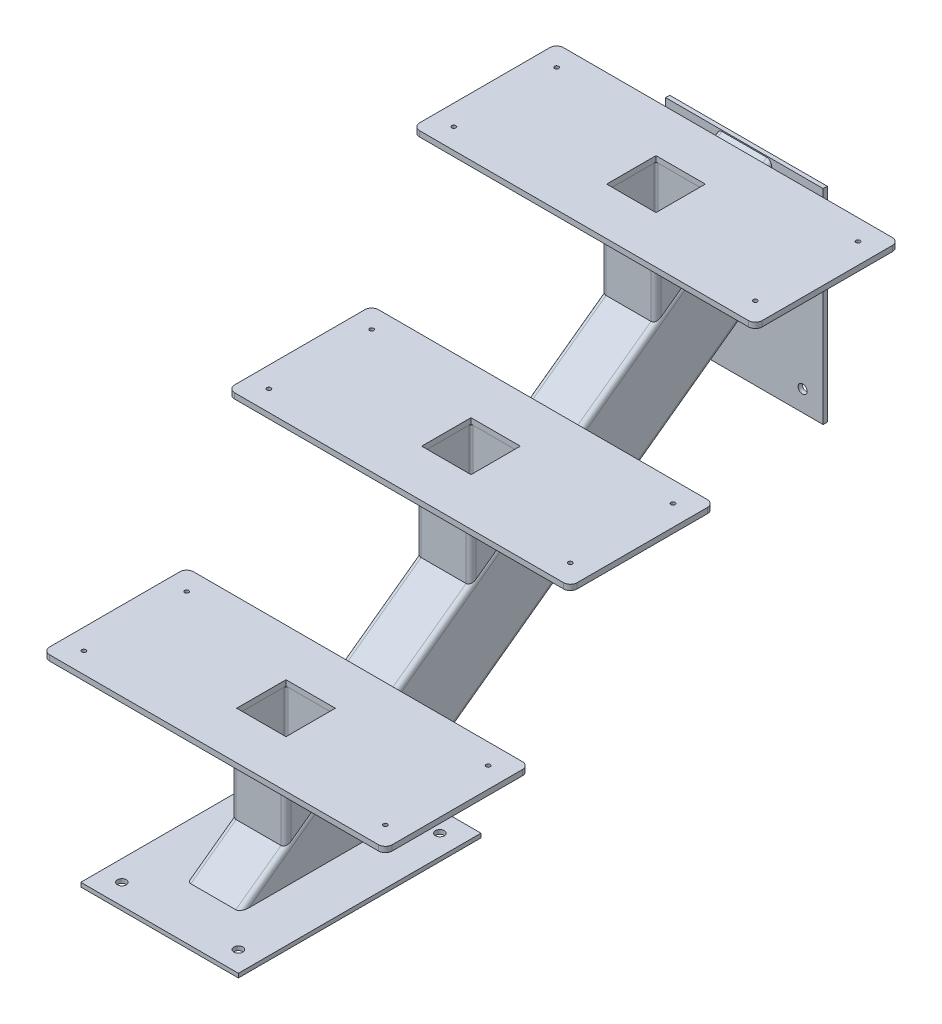
from build123d import *

# Parameters (mm, degrees)
BOSS_EXTRUDE1_START             = 3524.25
SKETCH1_W                       = 1000
SKETCH1_H                       = 270
BOSS_EXTRUDE1_DEPTH             = 40
BOSS_EXTRUDE2_START             = 3720.5
SKETCH1_53_W                    = 1000
SKETCH1_53_H                    = 270
BOSS_EXTRUDE2_DEPTH             = 40
BOSS_EXTRUDE3_START             = 3916.75
SKETCH1_54_W                    = 1000
SKETCH1_54_H                    = 270
BOSS_EXTRUDE3_DEPTH             = 40
MEMBER_8645_68_120_80_4_1_DEPTH = 975.849936604
MEMBER_8639_82_80_80_4_1_DEPTH  = 108.125
SKETCH20_R                      = 3
SKETCH20_W                      = 72
SKETCH20_H                      = 72
BASE_FLANGE1_DEPTH              = 8
BODY_START                      = 54.0625
BODY_5_RUN_ON_DEPTH             = 83.136574
TRIM_EXTEND6_START              = 3195.932240577
TRIM_EXTEND6_OUTLINE_W          = 80
TRIM_EXTEND6_OUTLINE_H          = 790.842725113
TRIM_EXTEND6_DEPTH              = 97.067759423
TRIM_EXTEND6_START_2            = 3293
TRIM_EXTEND6_2_OUTLINE_W        = 80
TRIM_EXTEND6_2_OUTLINE_H        = 72.157274887
TRIM_EXTEND6_2_DEPTH            = 575
END_START                       = -3847.887893241
END_CAP2_OUTLINE_W              = 6
END_CAP2_OUTLINE_H              = 354.099333146
END_CAP2_DEPTH                  = 230
END_START_2                     = 3293
END_CAP2_2_OUTLINE_W            = 83
END_CAP2_2_OUTLINE_H            = 784.842725113
END_CAP2_2_DEPTH                = 6
END_START_3                     = 3299
END_CAP2_3_OUTLINE_W            = 83
END_CAP2_3_OUTLINE_H            = 6
END_CAP2_3_DEPTH                = 569
END_CAP2_4_OUTLINE_W            = 298.349978258
END_CAP2_4_OUTLINE_H            = 6
END_CAP2_4_DEPTH                = 230
SKETCH25_R                      = 6.5
CUT_EXTRUDE1_DEPTH              = 10
SKETCH26_R                      = 6.5
CUT_EXTRUDE2_DEPTH              = 10


with BuildPart() as part:
    # Sketch1 → Boss-Extrude1 (new body)
    with BuildSketch(Plane(origin=(0, 0, 0), x_dir=(1, 0, 0), z_dir=(0, 1, 0)).offset(BOSS_EXTRUDE1_START)):
        with Locations((-3732.887893241, 4296.842725113)):
            Rectangle(SKETCH1_W, SKETCH1_H)
    extrude(amount=-BOSS_EXTRUDE1_DEPTH)


with BuildPart() as body_2:
    # Sketch1<53> → Boss-Extrude2 (new body)
    with BuildSketch(Plane(origin=(0, 0, 0), x_dir=(1, 0, 0), z_dir=(0, 1, 0)).offset(BOSS_EXTRUDE2_START)):
        with Locations((-3732.887893241, 4566.842725113)):
            Rectangle(SKETCH1_53_W, SKETCH1_53_H)
    extrude(amount=-BOSS_EXTRUDE2_DEPTH)


with BuildPart() as body_3:
    # Sketch1<54> → Boss-Extrude3 (new body)
    with BuildSketch(Plane(origin=(0, 0, 0), x_dir=(1, 0, 0), z_dir=(0, 1, 0)).offset(BOSS_EXTRUDE3_START)):
        with Locations((-3732.887893241, 4836.842725113)):
            Rectangle(SKETCH1_54_W, SKETCH1_54_H)
    extrude(amount=-BOSS_EXTRUDE3_DEPTH)


with BuildPart() as body_4:
    # Sketch18 → Member 8645-68 _ 120_80_4_1 (new body)
    with BuildSketch(Plane(origin=(-3732.887893241, 3818.216120289, -5007.119665459), x_dir=(1, 0, 0), z_dir=(7.982730478514927e-15, -0.5879490057630845, 0.8088979951898759))):
        with BuildLine():
            Line((-32.8, -60), (32.8, -60))
            ThreePointArc((32.8, -60), (37.891168825, -57.891168825), (40, -52.8))
            Line((40, -52.8), (40, 52.8))
            ThreePointArc((40, 52.8), (37.891168825, 57.891168825), (32.8, 60))
            Line((32.8, 60), (-32.8, 60))
            ThreePointArc((-32.8, 60), (-37.891168825, 57.891168825), (-40, 52.8))
            Line((-40, 52.8), (-40, -52.8))
            ThreePointArc((-40, -52.8), (-37.891168825, -57.891168825), (-32.8, -60))
        make_face()
        with BuildLine():
            Line((-32.8, -56), (32.8, -56))
            ThreePointArc((32.8, -56), (35.0627417, -55.0627417), (36, -52.8))
            Line((36, -52.8), (36, 52.8))
            ThreePointArc((36, 52.8), (35.0627417, 55.0627417), (32.8, 56))
            Line((32.8, 56), (-32.8, 56))
            ThreePointArc((-32.8, 56), (-35.0627417, 55.0627417), (-36, 52.8))
            Line((-36, 52.8), (-36, -52.8))
            ThreePointArc((-36, -52.8), (-35.0627417, -55.0627417), (-32.8, -56))
        make_face(mode=Mode.SUBTRACT)
    extrude(amount=MEMBER_8645_68_120_80_4_1_DEPTH)

    # Trim/Extend6: read off the stored shape, not the designer's step
    # Trim/Extend6 outline → Trim/Extend6 (cut)
    with BuildSketch(Plane(origin=(0, 0, 0), x_dir=(1, 0, 0), z_dir=(0, 1, 0)).offset(TRIM_EXTEND6_START)):
        with Locations((-3732.887893241, 4576.421362557)):
            Rectangle(TRIM_EXTEND6_OUTLINE_W, TRIM_EXTEND6_OUTLINE_H)
    extrude(amount=TRIM_EXTEND6_DEPTH, mode=Mode.SUBTRACT)

    # Trim_Extend6 2 outline → Trim_Extend6 2 (cut)
    with BuildSketch(Plane(origin=(0, 0, 0), x_dir=(1, 0, 0), z_dir=(0, 1, 0)).offset(TRIM_EXTEND6_START_2)):
        with Locations((-3732.887893241, 5007.921362557)):
            Rectangle(TRIM_EXTEND6_2_OUTLINE_W, TRIM_EXTEND6_2_OUTLINE_H)
    extrude(amount=TRIM_EXTEND6_2_DEPTH, mode=Mode.SUBTRACT)

    # End cap2 2 outline → End cap2 2 (cut)
    with BuildSketch(Plane(origin=(0, 0, 0), x_dir=(1, 0, 0), z_dir=(0, 1, 0)).offset(END_START_2)):
        with Locations((-3732.5, 4573.421362557)):
            Rectangle(END_CAP2_2_OUTLINE_W, END_CAP2_2_OUTLINE_H)
    extrude(amount=END_CAP2_2_DEPTH, mode=Mode.SUBTRACT)

    # End cap2 3 outline → End cap2 3 (cut)
    with BuildSketch(Plane(origin=(0, 0, 0), x_dir=(1, 0, 0), z_dir=(0, 1, 0)).offset(END_START_3)):
        with Locations((-3732.5, 4968.842725113)):
            Rectangle(END_CAP2_3_OUTLINE_W, END_CAP2_3_OUTLINE_H)
    extrude(amount=END_CAP2_3_DEPTH, mode=Mode.SUBTRACT)


with BuildPart() as body_5:
    # Sketch19 → Member 8639-82 _ 80_80_4_1 (new body)
    with BuildSketch(Plane(origin=(-3732.887893241, 3876.75, -4836.842725113), x_dir=(0, 0, -1), z_dir=(0, -1, 0))):
        with BuildLine():
            Line((-32.8, -40), (32.8, -40))
            ThreePointArc((32.8, -40), (37.891168825, -37.891168825), (40, -32.8))
            Line((40, -32.8), (40, 32.8))
            ThreePointArc((40, 32.8), (37.891168825, 37.891168825), (32.8, 40))
            Line((32.8, 40), (-32.8, 40))
            ThreePointArc((-32.8, 40), (-37.891168825, 37.891168825), (-40, 32.8))
            Line((-40, 32.8), (-40, -32.8))
            ThreePointArc((-40, -32.8), (-37.891168825, -37.891168825), (-32.8, -40))
        make_face()
        with BuildLine():
            Line((-32.8, -36), (32.8, -36))
            ThreePointArc((32.8, -36), (35.0627417, -35.0627417), (36, -32.8))
            Line((36, -32.8), (36, 32.8))
            ThreePointArc((36, 32.8), (35.0627417, 35.0627417), (32.8, 36))
            Line((32.8, 36), (-32.8, 36))
            ThreePointArc((-32.8, 36), (-35.0627417, 35.0627417), (-36, 32.8))
            Line((-36, 32.8), (-36, -32.8))
            ThreePointArc((-36, -32.8), (-35.0627417, -35.0627417), (-32.8, -36))
        make_face(mode=Mode.SUBTRACT)
    extrude(amount=MEMBER_8639_82_80_80_4_1_DEPTH)

    # body 5 cut square before the run-on
    split(bisect_by=Plane(origin=(-3732.887893241, 3822.6875, -4836.842725113), x_dir=(-1, 0, 0), z_dir=(0, 1, 0)), keep=Keep.TOP)

    # Sketch19 → body 5 run on (add)
    with BuildSketch(Plane(origin=(-3732.887893241, 3876.75, -4836.842725113), x_dir=(0, 0, -1), z_dir=(0, -1, 0)).offset(BODY_START)):
        with BuildLine():
            Line((-32.8, -40), (32.8, -40))
            ThreePointArc((32.8, -40), (37.891168825, -37.891168825), (40, -32.8))
            Line((40, -32.8), (40, 32.8))
            ThreePointArc((40, 32.8), (37.891168825, 37.891168825), (32.8, 40))
            Line((32.8, 40), (-32.8, 40))
            ThreePointArc((-32.8, 40), (-37.891168825, 37.891168825), (-40, 32.8))
            Line((-40, 32.8), (-40, -32.8))
            ThreePointArc((-40, -32.8), (-37.891168825, -37.891168825), (-32.8, -40))
        make_face()
        with BuildLine():
            Line((-32.8, -36), (32.8, -36))
            ThreePointArc((32.8, -36), (35.0627417, -35.0627417), (36, -32.8))
            Line((36, -32.8), (36, 32.8))
            ThreePointArc((36, 32.8), (35.0627417, 35.0627417), (32.8, 36))
            Line((32.8, 36), (-32.8, 36))
            ThreePointArc((-32.8, 36), (-35.0627417, 35.0627417), (-36, 32.8))
            Line((-36, 32.8), (-36, -32.8))
            ThreePointArc((-36, -32.8), (-35.0627417, -35.0627417), (-32.8, -36))
        make_face(mode=Mode.SUBTRACT)
    extrude(amount=BODY_5_RUN_ON_DEPTH)

    # Trim/Extend5
    split(bisect_by=Plane(origin=(-3732.887893241, 3868.75, -4836.842725113), x_dir=(1, 0, 0), z_dir=(0, -1, 0)), keep=Keep.TOP)

    # Trim_Extend5 3
    split(bisect_by=Plane(origin=(-3732.887893241, 3579.875, -4577.16119645), x_dir=(-1, 0, 0), z_dir=(0, 0.808897995, 0.587949006)), keep=Keep.TOP)


with BuildPart() as body_6:
    # Base-Flange1: sheet metal written as solids
    # Sketch20 → Base-Flange1 (new body)
    with BuildSketch(Plane.XZ.offset(-3876.75)):
        with BuildLine():
            Line((-3982.887893241, -4741.842725113), (-3982.887893241, -4931.842725113))
            ThreePointArc((-3982.887893241, -4931.842725113), (-3979.958961052, -4938.913792925), (-3972.887893241, -4941.842725113))
            Line((-3972.887893241, -4941.842725113), (-3492.887893241, -4941.842725113))
            ThreePointArc((-3492.887893241, -4941.842725113), (-3485.816825429, -4938.913792925), (-3482.887893241, -4931.842725113))
            Line((-3482.887893241, -4931.842725113), (-3482.887893241, -4741.842725113))
            ThreePointArc((-3482.887893241, -4741.842725113), (-3485.816825429, -4734.771657301), (-3492.887893241, -4731.842725113))
            Line((-3492.887893241, -4731.842725113), (-3972.887893241, -4731.842725113))
            ThreePointArc((-3972.887893241, -4731.842725113), (-3979.958961052, -4734.771657301), (-3982.887893241, -4741.842725113))
        make_face()
        with Locations(Location((-3952.887893241, -4761.842725113, 0), (0, 0, 270))):
            Circle(SKETCH20_R, mode=Mode.SUBTRACT)
        with Locations(Location((-3952.887893241, -4911.842725113, 0), (0, 0, 270))):
            Circle(SKETCH20_R, mode=Mode.SUBTRACT)
        with Locations(Location((-3512.887893241, -4911.842725113, 0), (0, 0, 270))):
            Circle(SKETCH20_R, mode=Mode.SUBTRACT)
        with Locations(Location((-3512.887893241, -4761.842725113, 0), (0, 0, 270))):
            Circle(SKETCH20_R, mode=Mode.SUBTRACT)
        with Locations((-3732.887893241, -4836.842725113)):
            Rectangle(SKETCH20_W, SKETCH20_H, mode=Mode.SUBTRACT)
    extrude(amount=BASE_FLANGE1_DEPTH)


with BuildPart() as body_7:
    # End cap2: read off the stored shape, not the designer's step
    # End cap2 outline → End cap2 (new body)
    with BuildSketch(Plane.YZ.offset(END_START)):
        with Locations((3296, -4289.382722332)):
            Rectangle(END_CAP2_OUTLINE_W, END_CAP2_OUTLINE_H)
    extrude(amount=END_CAP2_DEPTH)

    # Sketch25 → Cut-Extrude1 (cut)
    with BuildSketch(Plane(origin=(0, 3299, 0), x_dir=(1, 0, 0), z_dir=(0, 1, 0))):
        with Locations(Location((-3817.887893241, 4142.333055759, 0), (0, 0, 270))):
            Circle(SKETCH25_R)
        with Locations(Location((-3647.887893241, 4142.333055759, 0), (0, 0, 270))):
            Circle(SKETCH25_R)
        with Locations(Location((-3647.887893241, 4436.432388905, 0), (0, 0, 270))):
            Circle(SKETCH25_R)
        with Locations(Location((-3817.887893241, 4436.432388905, 0), (0, 0, 270))):
            Circle(SKETCH25_R)
    extrude(amount=-CUT_EXTRUDE1_DEPTH, mode=Mode.SUBTRACT)


with BuildPart() as body_8:
    # End cap2 4 outline → End cap2 4 (new body)
    with BuildSketch(Plane.YZ.offset(END_START)):
        with Locations((3789.047316836, -4968.842725113)):
            Rectangle(END_CAP2_4_OUTLINE_W, END_CAP2_4_OUTLINE_H)
    extrude(amount=END_CAP2_4_DEPTH)


with BuildPart() as body_8_1:
    # Body-Move/Copy3: moved
    add(body_8.part.moved(Location((0, -74.132409316, 0))))

    # Sketch26 → Cut-Extrude2 (cut)
    with BuildSketch(Plane.XY.offset(-4965.842725113)):
        with Locations((-3647.887893241, 3834.089896649)):
            Circle(SKETCH26_R)
        with Locations((-3647.887893241, 3595.739918391)):
            Circle(SKETCH26_R)
        with Locations((-3817.887893241, 3595.739918391)):
            Circle(SKETCH26_R)
        with Locations((-3817.887893241, 3834.089896649)):
            Circle(SKETCH26_R)
    extrude(amount=-CUT_EXTRUDE2_DEPTH, mode=Mode.SUBTRACT)


with BuildPart() as body_9:
    # Sketch-Pattern1: read off the stored shape, not the designer's step
    # Sketch-Pattern1: copy of body 5
    add(body_5.part.moved(Location((0, -392.5, 540))))


with BuildPart() as body_10:
    # Sketch-Pattern1 2: copy of body 5
    add(body_5.part.moved(Location((0, -196.25, 270))))


with BuildPart() as body_11:
    # Sketch-Pattern1 3: copy of body 6
    add(body_6.part.moved(Location((0, -392.5, 540))))


with BuildPart() as body_12:
    # Sketch-Pattern1 4: copy of body 6
    add(body_6.part.moved(Location((0, -196.25, 270))))


solid = Compound([body_4.part, body_5.part, body_6.part, body_7.part, body_8_1.part, body_9.part, body_10.part, body_11.part, body_12.part])
